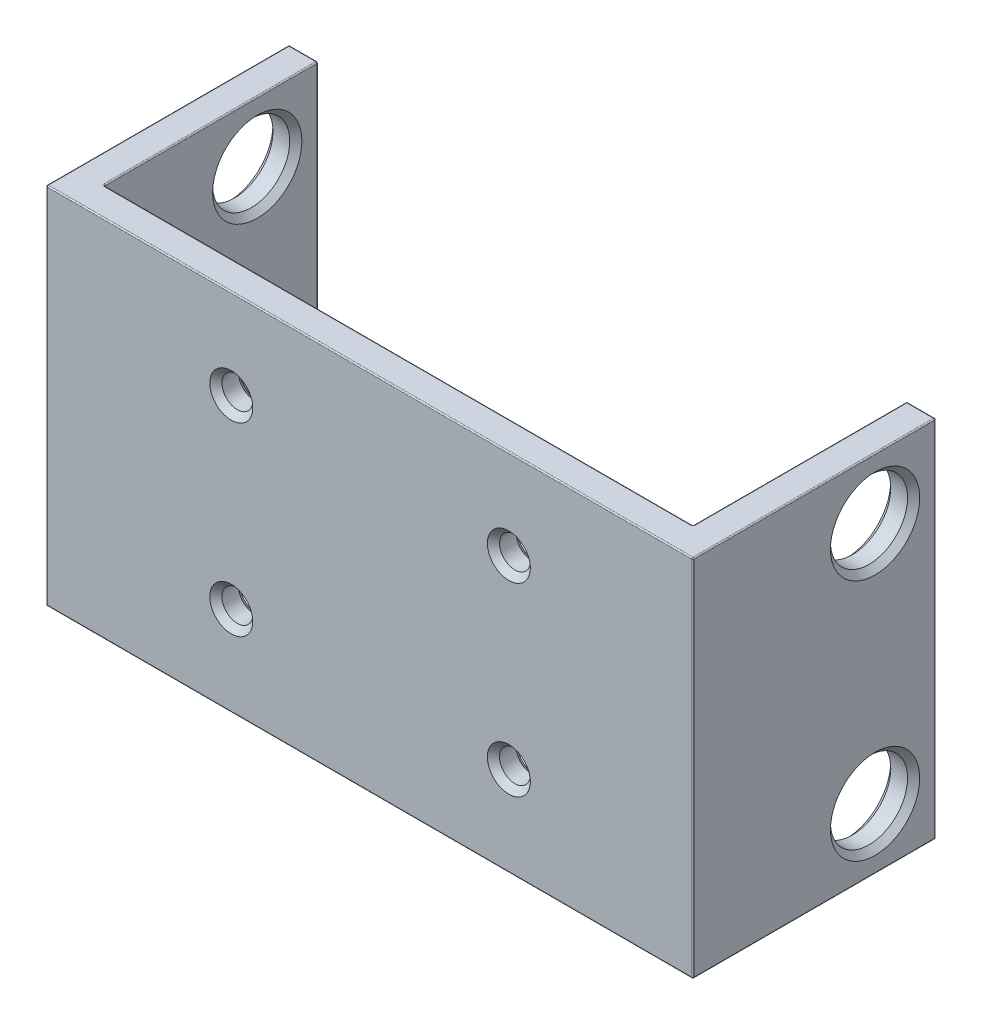
from build123d import *

# Parameters (mm, degrees)
BOSS_EXTRUDE1_DEPTH = 30
SKETCH2_R           = 1.27
CUT_EXTRUDE1_DEPTH  = 63.361058374
SKETCH3_R           = 3.175
CUT_EXTRUDE2_DEPTH  = 64.618505624
FILLET1_R           = 0.1
CHAMFER1_SIZE       = 0.5


with BuildPart() as part:
    # Sketch1 → Boss-Extrude1 (new body)
    with BuildSketch(Plane(origin=(0, 0, 0), x_dir=(1, 0, 0), z_dir=(0, 1, 0))):
        Polygon((0, 0), (0, 17.61875), (2.38125, 17.61875), (2.38125, -2.38125), (-50.88125, -2.38125), (-50.88125, 17.61875), (-48.5, 17.61875), (-48.5, 0), align=None)
    extrude(amount=BOSS_EXTRUDE1_DEPTH)

    # Sketch2 → Cut-Extrude1 (cut, through all)
    with BuildSketch(Plane.XY.offset(2.38125)):
        with Locations((-35.64, 7.38)):
            Circle(SKETCH2_R)
        with Locations((-12.78, 7.38)):
            Circle(SKETCH2_R)
        with Locations((-12.78, 22.62)):
            Circle(SKETCH2_R)
        with Locations((-35.64, 22.62)):
            Circle(SKETCH2_R)
    extrude(amount=-CUT_EXTRUDE1_DEPTH, mode=Mode.SUBTRACT)

    # Sketch3 → Cut-Extrude2 (cut, through all)
    with BuildSketch(Plane(origin=(2.38125, 0, 0), x_dir=(0, 0, -1), z_dir=(1, 0, 0))):
        with Locations((12.61875, 25)):
            Circle(SKETCH3_R)
        with Locations((12.61875, 5)):
            Circle(SKETCH3_R)
    extrude(amount=-CUT_EXTRUDE2_DEPTH, mode=Mode.SUBTRACT)

    # Fillet1
    fillet1_edges = [part.edges().sort_by_distance(p)[0] for p in [
        (-48.5, 15, -17.61875),
        (-50.88125, 15, -17.61875),
        (2.38125, 15, -17.61875),
        (0, 15, -17.61875),
        (-48.5, 0, -8.809375),
        (-49.690625, 0, -17.61875),
        (-50.88125, 0, -7.61875),
        (-24.25, 0, 2.38125),
        (2.38125, 0, -7.61875),
        (1.190625, 0, -17.61875),
        (0, 0, -8.809375),
        (-24.25, 0, 0),
        (0, 30, -8.809375),
        (1.190625, 30, -17.61875),
        (2.38125, 30, -7.61875),
        (-24.25, 30, 2.38125),
        (-50.88125, 30, -7.61875),
        (-49.690625, 30, -17.61875),
        (-48.5, 30, -8.809375),
        (-24.25, 30, 0),
        (-50.88125, 15, 2.38125),
        (2.38125, 15, 2.38125),
        (0, 15, 0),
        (-48.5, 15, 0),
    ]]
    fillet(fillet1_edges, radius=FILLET1_R)

    # Chamfer1
    chamfer1_edges = [part.edges().sort_by_distance(p)[0] for p in [
        (0, 5, -9.44375),
        (2.38125, 5, -9.44375),
        (0, 25, -9.44375),
        (2.38125, 25, -9.44375),
        (-48.5, 25, -9.44375),
        (-50.88125, 25, -9.44375),
        (-48.5, 5, -9.44375),
        (-50.88125, 5, -9.44375),
        (-14.05, 7.38, 0),
        (-14.05, 7.38, 2.38125),
        (-14.05, 22.62, 0),
        (-14.05, 22.62, 2.38125),
        (-36.91, 7.38, 0),
        (-36.91, 7.38, 2.38125),
        (-36.91, 22.62, 0),
        (-36.91, 22.62, 2.38125),
    ]]
    chamfer(chamfer1_edges, length=CHAMFER1_SIZE)


solid = part.part
